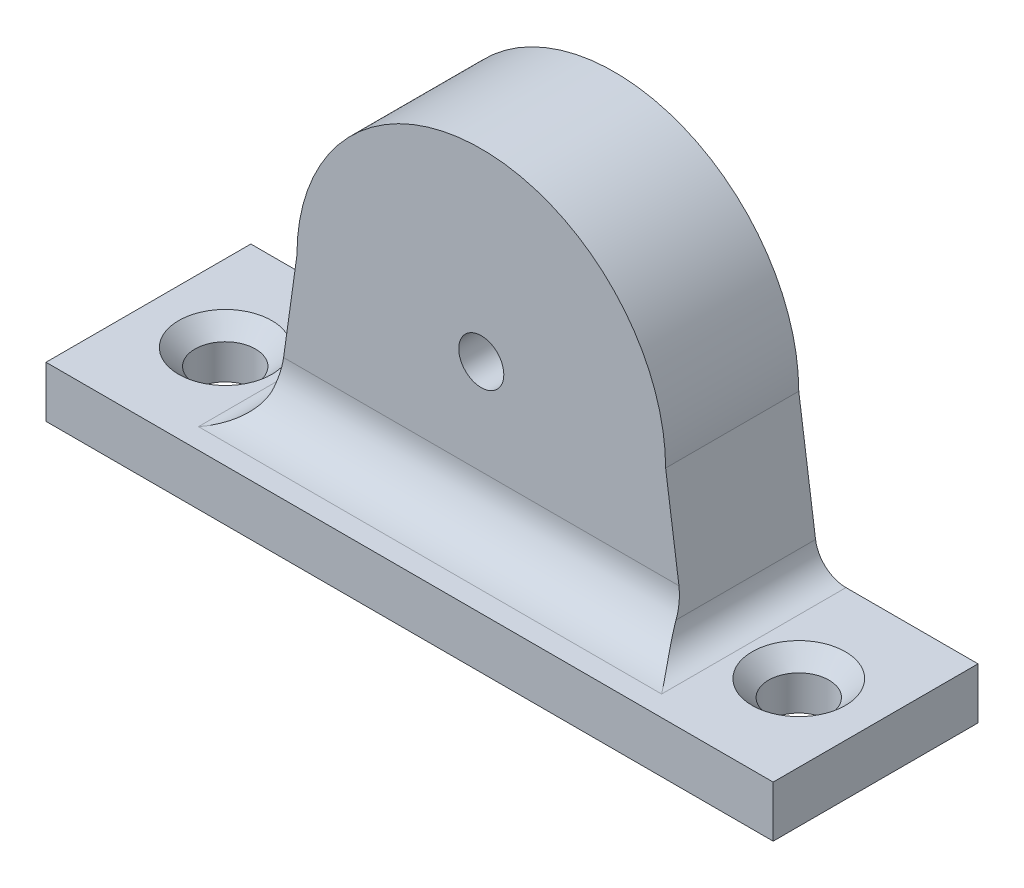
from build123d import *

# Parameters (mm, degrees)
SKETCH1_W           = 71
SKETCH1_H           = 20
BOSS_EXTRUDE1_DEPTH = 5
SKETCH2_R           = 2.95
CUT_EXTRUDE1_DEPTH  = 5
CHAMFER1_SIZE       = 1.6
SKETCH3_W           = 36
SKETCH3_H           = 13
BOSS_EXTRUDE2_DEPTH = 14.3
BOSS_EXTRUDE3_DEPTH = 13
CHAMFER2_START      = -20.499775095
CHAMFER2_OUTLINE_W  = 14.439182802
CHAMFER2_OUTLINE_H  = 13
CHAMFER2_DEPTH      = 2.499775095
CHAMFER3_START      = 18
CHAMFER3_OUTLINE_W  = 14.439182802
CHAMFER3_OUTLINE_H  = 13
CHAMFER3_DEPTH      = 2.499775095
SKETCH6_R           = 2.2
CUT_EXTRUDE2_DEPTH  = 12
FILLET2_R           = 3
FILLET3_R           = 5


with BuildPart() as part:
    # Sketch1 → Boss-Extrude1 (new body)
    with BuildSketch(Plane(origin=(0, 0, 0), x_dir=(1, 0, 0), z_dir=(0, 1, 0))):
        Rectangle(SKETCH1_W, SKETCH1_H)
    extrude(amount=BOSS_EXTRUDE1_DEPTH)

    # Sketch2 → Cut-Extrude1 (cut)
    with BuildSketch(Plane(origin=(0, 5, 0), x_dir=(1, 0, 0), z_dir=(0, 1, 0))):
        with Locations(Location((28, 0, 0), (0, 0, 270))):
            Circle(SKETCH2_R)
        with Locations(Location((-28, 0, 0), (0, 0, 270))):
            Circle(SKETCH2_R)
    extrude(amount=-CUT_EXTRUDE1_DEPTH, mode=Mode.SUBTRACT)

    # Chamfer1
    chamfer1_edges = [part.edges().sort_by_distance(p)[0] for p in [
        (28, 5, -2.95),
        (-28, 5, -2.95),
    ]]
    chamfer(chamfer1_edges, length=CHAMFER1_SIZE)

    # Sketch3 → Boss-Extrude2 (add)
    with BuildSketch(Plane(origin=(0, 5, 0), x_dir=(1, 0, 0), z_dir=(0, 1, 0))):
        with Locations((0, 3.5)):
            Rectangle(SKETCH3_W, SKETCH3_H)
    extrude(amount=BOSS_EXTRUDE2_DEPTH)

    # Sketch5 → Boss-Extrude3 (add)
    with BuildSketch(Plane(origin=(0, 0, -10), x_dir=(-1, 0, 0), z_dir=(0, 0, -1))):
        with BuildLine():
            Line((-18, 19.3), (18, 19.3))
            ThreePointArc((18, 19.3), (0, 37.3), (-18, 19.3))
        make_face()
    extrude(amount=-BOSS_EXTRUDE3_DEPTH)

    # Chamfer2: read off the stored shape, not the designer's step
    # Chamfer2 outline → Chamfer2 (add)
    with BuildSketch(Plane(origin=(0, 0, 0), x_dir=(0.13851199388326604, 0.9903607562653531, 0), z_dir=(0.9903607562653531, -0.13851199388326602, 0)).offset(CHAMFER2_START)):
        with Locations((9.401155305, -3.5)):
            Rectangle(CHAMFER2_OUTLINE_W, CHAMFER2_OUTLINE_H)
    extrude(amount=CHAMFER2_DEPTH)

    # Chamfer3: read off the stored shape, not the designer's step
    # Chamfer3 outline → Chamfer3 (add)
    with BuildSketch(Plane(origin=(0, 0, 0), x_dir=(-0.13851199388326604, 0.9903607562653531, 0), z_dir=(0.9903607562653531, 0.13851199388326602, 0)).offset(CHAMFER3_START)):
        with Locations((9.401155305, -3.5)):
            Rectangle(CHAMFER3_OUTLINE_W, CHAMFER3_OUTLINE_H)
    extrude(amount=CHAMFER3_DEPTH)

    # Sketch6 → Cut-Extrude2 (cut)
    with BuildSketch(Plane.XY.offset(3)):
        with Locations((0, 19.3)):
            Circle(SKETCH6_R)
    extrude(amount=-CUT_EXTRUDE2_DEPTH, mode=Mode.SUBTRACT)

    # Fillet2
    fillet2_edges = [part.edges().sort_by_distance(p)[0] for p in [
        (-20, 5, -3.5),
        (20, 5, -3.5),
    ]]
    fillet(fillet2_edges, radius=FILLET2_R)

    # Fillet3
    fillet3_edges = [part.edges().sort_by_distance(p)[0] for p in [
        (-1, 5, 3),
    ]]
    fillet(fillet3_edges, radius=FILLET3_R)


solid = part.part
